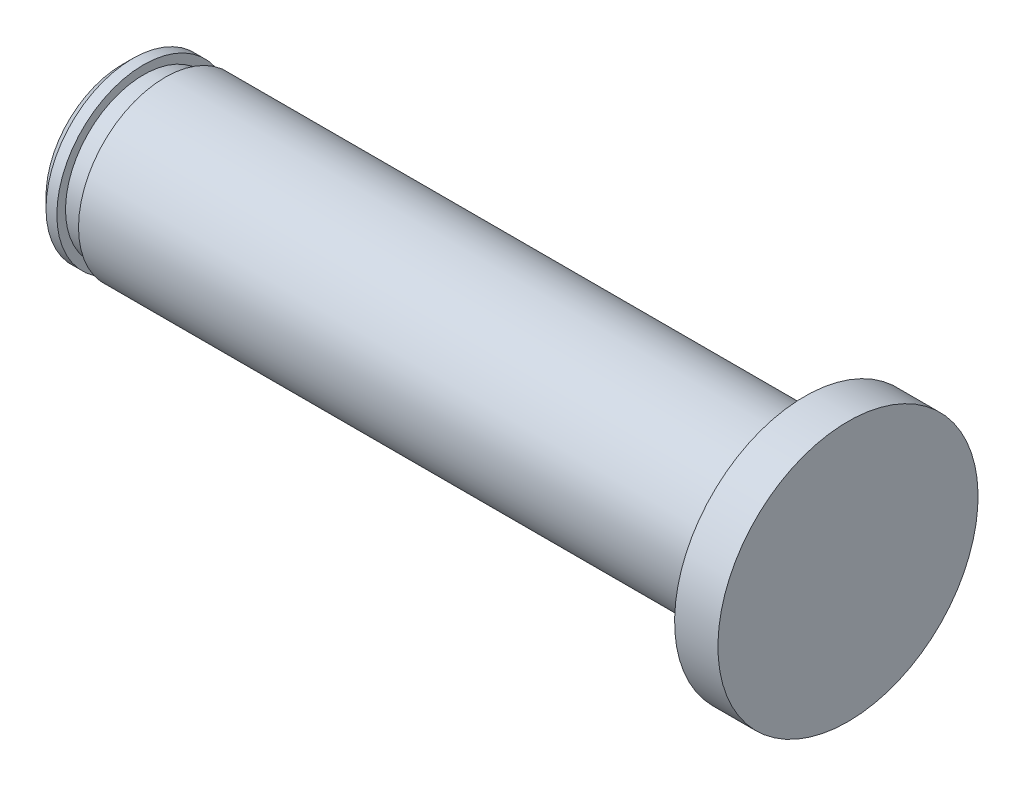
from build123d import *

# Parameters (mm, degrees)
CHAMFER_1_SIZE = 0.5


with BuildPart() as part:
    # Эскиз1 → Повернуть1 (revolve)
    with BuildSketch(Plane.XY):
        Polygon((0, 0), (-33.5, 0), (-33.5, 4), (-32.5, 4), (-32.5, 3.6), (-31.5, 3.6), (-31.5, 4), (-2, 4), (-2, 6), (0, 6), align=None)
    revolve(axis=Axis((-33.5, 0, 0), (1, 0, 0)))

    # Фаска1
    chamfer_1_edges = [part.edges().sort_by_distance(p)[0] for p in [
        (-33.5, -4, 0),
    ]]
    chamfer(chamfer_1_edges, length=CHAMFER_1_SIZE)


solid = part.part
